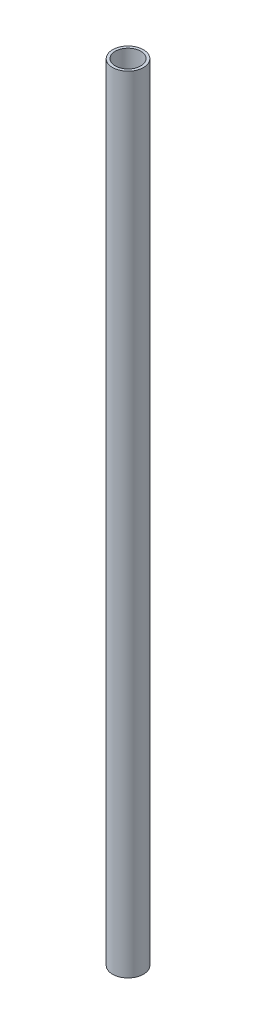
from build123d import *

# Parameters (mm, degrees)
SKETCH1_R           = 5.9944
SKETCH1_R_2         = 4.953
BOSS_EXTRUDE1_DEPTH = 304.8


with BuildPart() as part:
    # Sketch1 → Boss-Extrude1 (new body)
    with BuildSketch(Plane(origin=(0, 0, 0), x_dir=(1, 0, 0), z_dir=(0, 1, 0))):
        Circle(SKETCH1_R)
        Circle(SKETCH1_R_2, mode=Mode.SUBTRACT)
    extrude(amount=BOSS_EXTRUDE1_DEPTH)


solid = part.part
